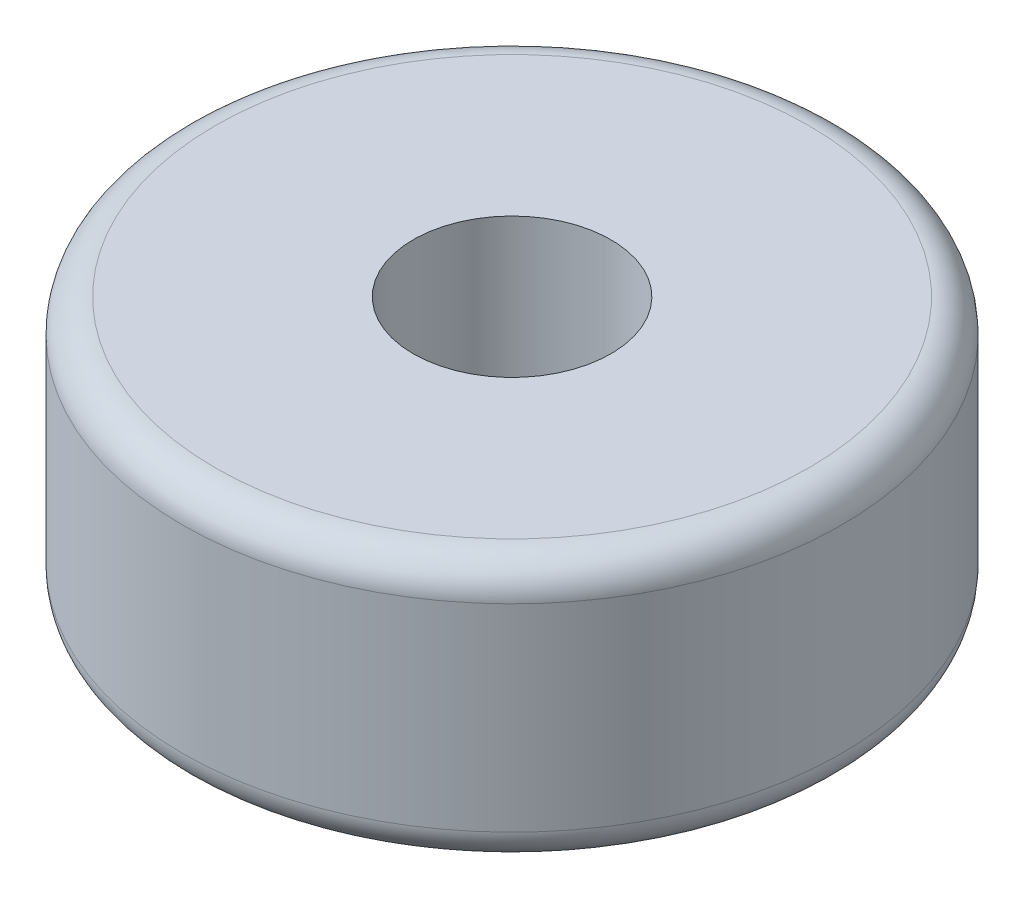
from build123d import *

# Parameters (mm, degrees)
SKETCH1_R           = 5
SKETCH1_R_2         = 1.5
BOSS_EXTRUDE1_DEPTH = 4
FILLET1_R           = 0.5


with BuildPart() as part:
    # Sketch1 → Boss-Extrude1 (new body)
    with BuildSketch(Plane(origin=(0, 0, 0), x_dir=(1, 0, 0), z_dir=(0, 1, 0))):
        Circle(SKETCH1_R)
        Circle(SKETCH1_R_2, mode=Mode.SUBTRACT)
    extrude(amount=BOSS_EXTRUDE1_DEPTH)

    # Fillet1
    fillet1_edges = [part.edges().sort_by_distance(p)[0] for p in [
        (-5, 0, 0),
        (-5, 4, 0),
    ]]
    fillet(fillet1_edges, radius=FILLET1_R)


solid = part.part
